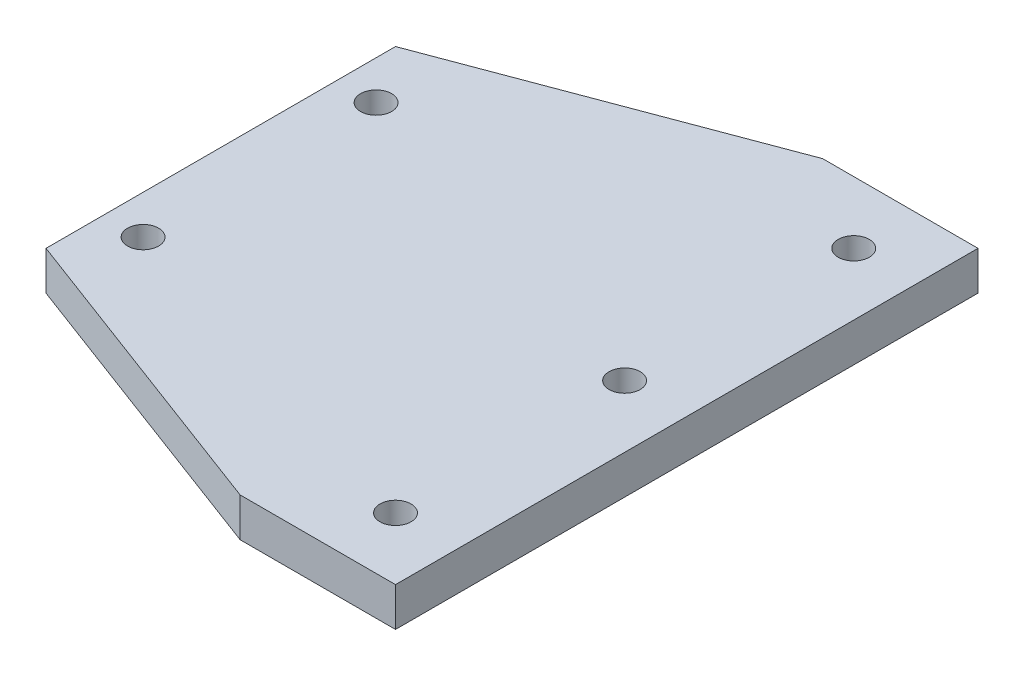
from build123d import *

# Parameters (mm, degrees)
BOSS_EXTRUDE1_OUTLINE_W = 120
BOSS_EXTRUDE1_OUTLINE_H = 150
BOSS_EXTRUDE1_DEPTH     = 10
CHAMFER1_SIZE           = 30
CHAMFER1_SIZE2          = 80
CHAMFER2_SIZE           = 80
CHAMFER2_SIZE2          = 30
SKETCH2_R               = 4
CUT_EXTRUDE1_DEPTH      = 10
SCALE1_SCALE            = 7.5


# Read off the part's stored shape, not the designer's step: Boss-Extrude1
with BuildPart() as part:
    # Boss-Extrude1 outline → Boss-Extrude1 (new body)
    with BuildSketch(Plane(origin=(0, 0, 0), x_dir=(1, 0, 0), z_dir=(0, 1, 0))):
        with Locations((60, 75)):
            Rectangle(BOSS_EXTRUDE1_OUTLINE_W, BOSS_EXTRUDE1_OUTLINE_H)
    extrude(amount=BOSS_EXTRUDE1_DEPTH)

    # Chamfer1
    chamfer1_edges = [part.edges().sort_by_distance(p)[0] for p in [
        (0, 5, 0),
    ]]
    chamfer1_side = [part.faces().sort_by_distance(p)[0] for p in [
        (0, 5, -75),
    ]]
    chamfer(chamfer1_edges, length=CHAMFER1_SIZE, length2=CHAMFER1_SIZE2, reference=chamfer1_side[0])

    # Chamfer2
    chamfer2_edges = [part.edges().sort_by_distance(p)[0] for p in [
        (0, 5, -150),
    ]]
    chamfer2_side = [part.faces().sort_by_distance(p)[0] for p in [
        (60, 5, -150),
    ]]
    chamfer(chamfer2_edges, length=CHAMFER2_SIZE, length2=CHAMFER2_SIZE2, reference=chamfer2_side[0])

    # Sketch2 → Cut-Extrude1 (cut)
    with BuildSketch(Plane(origin=(0, 10, 0), x_dir=(1, 0, 0), z_dir=(0, 1, 0))):
        with Locations(Location((104, 134, 0), (0, 0, 270))):
            Circle(SKETCH2_R)
        with Locations(Location((104, 16, 0), (0, 0, 270))):
            Circle(SKETCH2_R)
        with Locations(Location((10, 105, 0), (0, 0, 270))):
            Circle(SKETCH2_R)
        with Locations(Location((10, 45, 0), (0, 0, 270))):
            Circle(SKETCH2_R)
        with Locations(Location((104, 75, 0), (0, 0, 270))):
            Circle(SKETCH2_R)
    extrude(amount=-CUT_EXTRUDE1_DEPTH, mode=Mode.SUBTRACT)


with BuildPart() as part_1:
    # Scale1: scaled about (65.107380076, 5, -75)
    add(part.part.scale(SCALE1_SCALE).moved(Location((-423.197970494, -32.5, 487.5))))


solid = part_1.part
